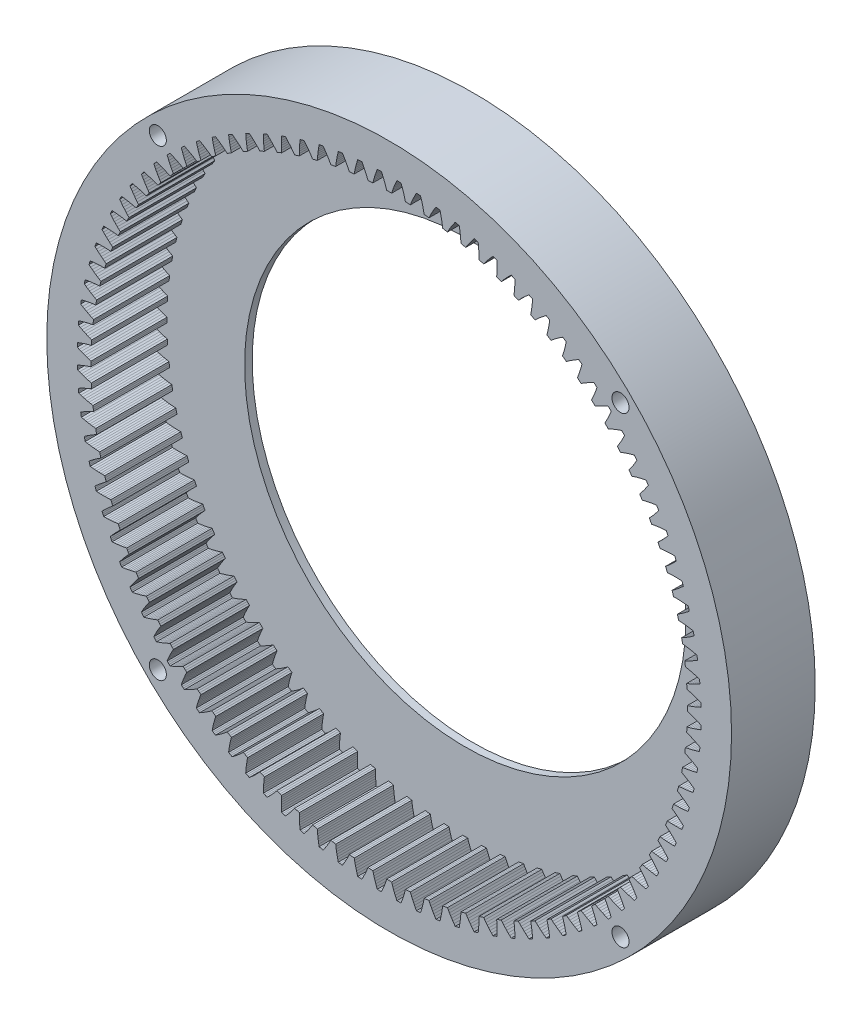
from build123d import *

# Parameters (mm, degrees)
INTERNAL_RING_TEETH_START = 35
SKETCH_1_R                = 90
INTERNAL_RING_TEETH_DEPTH = 20
RING_BACK_FLANGE_START    = 33
SKETCH_2_R                = 90
SKETCH_2_R_2              = 58
RING_BACK_FLANGE_DEPTH    = 2
SKETCH_3_R                = 2.25
THROUGH_HOLES_DEPTH       = 100


with BuildPart() as part:
    # Эскиз1 → Internal_ring_teeth (new body)
    with BuildSketch(Plane.XY.offset(INTERNAL_RING_TEETH_START)):
        Circle(SKETCH_1_R)
        Polygon((81.974683469, -2.037466591), (81.465701821, -1.805840391), (80.955920355, -1.584678023), (80.445404963, -1.374284213), (79.934221415, -1.175012738), (79.422435353, -0.987280005), (78.910112284, -0.811584339), (78.397317575, -0.648534495), (78.399701951, -0.216180357), (78.399701951, 0.216180357), (78.397317575, 0.648534495), (78.910112284, 0.811584339), (79.422435353, 0.987280005), (79.934221415, 1.175012738), (80.445404963, 1.374284213), (80.955920355, 1.584678023), (81.465701821, 1.805840391), (81.974683469, 2.037466591), (81.964979124, 2.39628822), (81.953704143, 2.75506393), (81.940858743, 3.113786847), (81.418337524, 3.312996763), (80.895675095, 3.501713275), (80.372956352, 3.679636395), (79.850269149, 3.846417172), (79.327705143, 4.001644144), (78.805361005, 4.144824084), (78.283340195, 4.27535354), (78.258572125, 4.707004242), (78.231423971, 5.13851179), (78.201896559, 5.569863061), (78.7034414, 5.764789809), (79.203721495, 5.972307812), (79.702709828, 6.19180541), (80.200372312, 6.422781148), (80.696669582, 6.664815321), (81.191558211, 6.917550719), (81.684991571, 7.18067908), (81.652775778, 7.538183315), (81.618995333, 7.895543101), (81.583650882, 8.252751591), (81.049652245, 8.418759033), (80.516171563, 8.57428491), (79.983312401, 8.719035158), (79.45118435, 8.852667031), (78.919904723, 8.974775633), (78.389600969, 9.08487478), (77.860414235, 9.182368708), (77.808591468, 9.611612446), (77.754402301, 10.040563866), (77.697848385, 10.469209921), (78.18616399, 10.695244287), (78.672426732, 10.933765648), (79.156648058, 11.184161854), (79.638825433, 11.445930301), (80.118945921, 11.718649638), (80.596988614, 12.001960634), (81.072926329, 12.295552708), (81.018326231, 12.650328644), (80.962173636, 13.004862171), (80.904469623, 13.359146495), (80.361101017, 13.491296307), (79.818907487, 13.613017761), (79.278010857, 13.724023873), (78.738542024, 13.823979457), (78.200643494, 13.912487782), (77.66447299, 13.989071625), (77.130208792, 14.053145261), (77.051535847, 14.478288007), (76.970519528, 14.902990423), (76.887162299, 15.327239593), (77.36032151, 15.583489523), (77.830647844, 15.852072906), (78.298191161, 16.132379521), (78.762980492, 16.423907595), (79.225029384, 16.726235798), (79.684339524, 17.039004294), (80.140903286, 17.361901408), (80.064134363, 17.712548906), (79.985831229, 18.062856991), (79.905995384, 18.412818951), (79.355401236, 18.510589599), (78.806634648, 18.598026249), (78.259835223, 18.674850136), (77.715154646, 18.740734952), (77.172760052, 18.795293698), (76.632838819, 18.838059996), (76.095605651, 18.868460471), (75.990393016, 19.287824379), (75.882869279, 19.706601685), (75.773037711, 20.124779653), (76.229173183, 20.410233844), (76.681706945, 20.707819275), (77.130727075, 21.016930057), (77.576294051, 21.33706723), (78.01844785, 21.667811148), (78.45721275, 22.008802788), (78.89260071, 22.359730614), (78.793965935, 22.704865829), (78.693821287, 23.049565966), (78.592168687, 23.393824422), (78.036521941, 23.45683005), (77.483348026, 23.509636825), (76.932803773, 23.551975297), (76.385061056, 23.583529328), (75.840310982, 23.603923176), (75.298769842, 23.61270315), (74.76068792, 23.609310487), (74.62935082, 24.02124052), (74.495744012, 24.432439994), (74.35987156, 24.842896402), (74.797183136, 25.156428298), (75.230138382, 25.481841341), (75.658863247, 25.818536371), (76.083449419, 26.166019209), (76.503963146, 26.523873545), (76.920451201, 26.891742593), (77.332945083, 27.269316179), (77.21283372, 27.607577019), (77.091242785, 27.945308836), (76.968174605, 28.282505156), (76.409668146, 28.310497109), (75.854270028, 28.328465604), (75.302153693, 28.336151572), (74.753510528, 28.333250288), (74.208554853, 28.319398753), (73.667531022, 28.294157752), (73.130723909, 28.25698534), (72.973780672, 28.659855799), (72.814618078, 29.061854624), (72.653240967, 29.462969588), (73.070002779, 29.803341821), (73.481670833, 30.155298221), (73.888408451, 30.518248717), (74.290338171, 30.891705863), (74.687552251, 31.275258331), (75.080119773, 31.668552975), (75.46809165, 32.071282211), (75.326977727, 32.401333716), (75.184420367, 32.730764338), (75.040422302, 33.059567763), (74.481260298, 33.052435569), (73.92582988, 33.035494872), (73.374320415, 33.008498001), (72.826942045, 32.971152853), (72.283931461, 32.923110602), (71.745560112, 32.863948241), (71.212146341, 32.793142782), (71.03021635, 33.185363721), (70.846126112, 33.576575391), (70.659881225, 33.966765893), (71.054448503, 34.332635171), (71.443204699, 34.709745916), (71.826349863, 35.097519478), (72.204036898, 35.495477068), (72.576383708, 35.903213962), (72.943481413, 36.320382047), (73.305400139, 36.746677544), (73.143840565, 37.067217151), (72.98087939, 37.387046466), (72.816519735, 37.70615936), (72.258908943, 37.663931167), (71.705638256, 37.612148134), (71.156912216, 37.55057497), (70.612958894, 37.478933342), (70.074036415, 37.396889974), (69.540442254, 37.304039739), (69.012526965, 37.199880671), (68.806328214, 37.579904173), (68.598036852, 37.958784754), (68.387659213, 38.336510892), (68.75847478, 38.726433294), (69.122784875, 39.127210101), (69.480825486, 39.538276365), (69.832779279, 39.959163841), (70.178789336, 40.389476009), (70.518968457, 40.828871163), (70.853405702, 41.277050529), (70.672038082, 41.586813215), (70.489316224, 41.895779003), (70.305243631, 42.203941972), (69.751384687, 42.126784436), (69.202457236, 42.04036343), (68.658680194, 41.944456974), (68.120298654, 41.838801602), (67.587591161, 41.723080906), (67.060880041, 41.596909235), (66.540546673, 41.459807627), (66.310892936, 41.826133912), (66.079222481, 42.191188136), (65.845542353, 42.554959196), (66.191142771, 42.967395878), (66.529568999, 43.390257063), (66.861092034, 43.822993738), (67.185923583, 44.26515005), (67.504231344, 44.716339246), (67.816149349, 45.176227379), (68.121785244, 45.644521853), (67.921325351, 45.942285126), (67.719563931, 46.23916804), (67.51650485, 46.535164907), (66.968583582, 46.423382532), (66.426165734, 46.302664619), (65.889483727, 46.172803369), (65.358798716, 46.033551227), (64.834408562, 45.884609899), (64.316659171, 45.725614735), (63.805961244, 45.556111662), (63.553758858, 45.907295009), (63.299623607, 46.257082173), (63.04356322, 46.605462518), (63.36258456, 47.03878578), (63.673791308, 47.482062504), (63.977488398, 47.934761775), (64.273915742, 48.396441935), (64.56326499, 48.866727522), (64.845690882, 49.345293664), (65.121319221, 49.831855102), (64.902558179, 50.116443827), (64.682553456, 50.400072206), (64.461309269, 50.682734805), (63.921488072, 50.536768746), (63.387720502, 50.382230344), (62.86025157, 50.218926803), (62.339357459, 50.046627457), (61.825354173, 49.8650533), (61.318609831, 49.673862123), (60.819562835, 49.472626538), (60.545807129, 49.807280985), (60.270210038, 50.14042064), (59.992779945, 50.472035371), (60.283963177, 50.924535084), (60.566722253, 51.386477937), (60.841394844, 51.857353207), (61.108248118, 52.336735174), (61.367496926, 52.824261149), (61.619316098, 53.319616618), (61.863849102, 53.822524786), (61.627650261, 54.09281582), (61.390270494, 54.362070312), (61.15171435, 54.630283104), (60.622123652, 54.450709422), (60.099112897, 54.262960423), (59.582938719, 54.066859076), (59.073891238, 53.862192511), (58.572303356, 53.648702116), (58.078563952, 53.426069471), (57.593137398, 53.193895558), (57.298908759, 53.510700379), (57.002937484, 53.825877774), (56.705232575, 54.139418159), (56.967428531, 54.609308514), (57.220624015, 55.088094417), (57.4651881, 55.575287357), (57.701414158, 56.070479229), (57.929539388, 56.57332155), (58.149758024, 57.083511405), (58.362230633, 57.600781553), (58.109526163, 57.855708181), (57.855708181, 58.109526163), (57.600781553, 58.362230633), (57.083511405, 58.149758024), (56.57332155, 57.929539388), (56.070479229, 57.701414158), (55.575287357, 57.4651881), (55.088094417, 57.220624015), (54.609308514, 56.967428531), (54.139418159, 56.705232575), (53.825877774, 57.002937484), (53.510700379, 57.298908759), (53.193895558, 57.593137398), (53.426069471, 58.078563952), (53.648702116, 58.572303356), (53.862192511, 59.073891238), (54.066859076, 59.582938719), (54.262960423, 60.099112897), (54.450709422, 60.622123652), (54.630283104, 61.15171435), (54.362070312, 61.390270494), (54.09281582, 61.627650261), (53.822524786, 61.863849102), (53.319616618, 61.619316098), (52.824261149, 61.367496926), (52.336735174, 61.108248118), (51.857353207, 60.841394844), (51.386477937, 60.566722253), (50.924535084, 60.283963177), (50.472035371, 59.992779945), (50.14042064, 60.270210038), (49.807280985, 60.545807129), (49.472626538, 60.819562835), (49.673862123, 61.318609831), (49.8650533, 61.825354173), (50.046627457, 62.339357459), (50.218926803, 62.86025157), (50.382230344, 63.387720502), (50.536768746, 63.921488072), (50.682734805, 64.461309269), (50.400072206, 64.682553456), (50.116443827, 64.902558179), (49.831855102, 65.121319221), (49.345293664, 64.845690882), (48.866727522, 64.56326499), (48.396441935, 64.273915742), (47.934761775, 63.977488398), (47.482062504, 63.673791308), (47.03878578, 63.36258456), (46.605462518, 63.04356322), (46.257082173, 63.299623607), (45.907295009, 63.553758858), (45.556111662, 63.805961244), (45.725614735, 64.316659171), (45.884609899, 64.834408562), (46.033551227, 65.358798716), (46.172803369, 65.889483727), (46.302664619, 66.426165734), (46.423382532, 66.968583582), (46.535164907, 67.51650485), (46.23916804, 67.719563931), (45.942285126, 67.921325351), (45.644521853, 68.121785244), (45.176227379, 67.816149349), (44.716339246, 67.504231344), (44.26515005, 67.185923583), (43.822993738, 66.861092034), (43.390257063, 66.529568999), (42.967395878, 66.191142771), (42.554959196, 65.845542353), (42.191188136, 66.079222481), (41.826133912, 66.310892936), (41.459807627, 66.540546673), (41.596909235, 67.060880041), (41.723080906, 67.587591161), (41.838801602, 68.120298654), (41.944456974, 68.658680194), (42.04036343, 69.202457236), (42.126784436, 69.751384687), (42.203941972, 70.305243631), (41.895779003, 70.489316224), (41.586813215, 70.672038082), (41.277050529, 70.853405702), (40.828871163, 70.518968457), (40.389476009, 70.178789336), (39.959163841, 69.832779279), (39.538276365, 69.480825486), (39.127210101, 69.122784875), (38.726433294, 68.75847478), (38.336510892, 68.387659213), (37.958784754, 68.598036852), (37.579904173, 68.806328214), (37.199880671, 69.012526965), (37.304039739, 69.540442254), (37.396889974, 70.074036415), (37.478933342, 70.612958894), (37.55057497, 71.156912216), (37.612148134, 71.705638256), (37.663931167, 72.258908943), (37.70615936, 72.816519735), (37.387046466, 72.98087939), (37.067217151, 73.143840565), (36.746677544, 73.305400139), (36.320382047, 72.943481413), (35.903213962, 72.576383708), (35.495477068, 72.204036898), (35.097519478, 71.826349863), (34.709745916, 71.443204699), (34.332635171, 71.054448503), (33.966765893, 70.659881225), (33.576575391, 70.846126112), (33.185363721, 71.03021635), (32.793142782, 71.212146341), (32.863948241, 71.745560112), (32.923110602, 72.283931461), (32.971152853, 72.826942045), (33.008498001, 73.374320415), (33.035494872, 73.92582988), (33.052435569, 74.481260298), (33.059567763, 75.040422302), (32.730764338, 75.184420367), (32.401333716, 75.326977727), (32.071282211, 75.46809165), (31.668552975, 75.080119773), (31.275258331, 74.687552251), (30.891705863, 74.290338171), (30.518248717, 73.888408451), (30.155298221, 73.481670833), (29.803341821, 73.070002779), (29.462969588, 72.653240967), (29.061854624, 72.814618078), (28.659855799, 72.973780672), (28.25698534, 73.130723909), (28.294157752, 73.667531022), (28.319398753, 74.208554853), (28.333250288, 74.753510528), (28.336151572, 75.302153693), (28.328465604, 75.854270028), (28.310497109, 76.409668146), (28.282505156, 76.968174605), (27.945308836, 77.091242785), (27.607577019, 77.21283372), (27.269316179, 77.332945083), (26.891742593, 76.920451201), (26.523873545, 76.503963146), (26.166019209, 76.083449419), (25.818536371, 75.658863247), (25.481841341, 75.230138382), (25.156428298, 74.797183136), (24.842896402, 74.35987156), (24.432439994, 74.495744012), (24.02124052, 74.62935082), (23.609310487, 74.76068792), (23.61270315, 75.298769842), (23.603923176, 75.840310982), (23.583529328, 76.385061056), (23.551975297, 76.932803773), (23.509636825, 77.483348026), (23.45683005, 78.036521941), (23.393824422, 78.592168687), (23.049565966, 78.693821287), (22.704865829, 78.793965935), (22.359730614, 78.89260071), (22.008802788, 78.45721275), (21.667811148, 78.01844785), (21.33706723, 77.576294051), (21.016930057, 77.130727075), (20.707819275, 76.681706945), (20.410233844, 76.229173183), (20.124779653, 75.773037711), (19.706601685, 75.882869279), (19.287824379, 75.990393016), (18.868460471, 76.095605651), (18.838059996, 76.632838819), (18.795293698, 77.172760052), (18.740734952, 77.715154646), (18.674850136, 78.259835223), (18.598026249, 78.806634648), (18.510589599, 79.355401236), (18.412818951, 79.905995384), (18.062856991, 79.985831229), (17.712548906, 80.064134363), (17.361901408, 80.140903286), (17.039004294, 79.684339524), (16.726235798, 79.225029384), (16.423907595, 78.762980492), (16.132379521, 78.298191161), (15.852072906, 77.830647844), (15.583489523, 77.36032151), (15.327239593, 76.887162299), (14.902990423, 76.970519528), (14.478288007, 77.051535847), (14.053145261, 77.130208792), (13.989071625, 77.66447299), (13.912487782, 78.200643494), (13.823979457, 78.738542024), (13.724023873, 79.278010857), (13.613017761, 79.818907487), (13.491296307, 80.361101017), (13.359146495, 80.904469623), (13.004862171, 80.962173636), (12.650328644, 81.018326231), (12.295552708, 81.072926329), (12.001960634, 80.596988614), (11.718649638, 80.118945921), (11.445930301, 79.638825433), (11.184161854, 79.156648058), (10.933765648, 78.672426732), (10.695244287, 78.18616399), (10.469209921, 77.697848385), (10.040563866, 77.754402301), (9.611612446, 77.808591468), (9.182368708, 77.860414235), (9.08487478, 78.389600969), (8.974775633, 78.919904723), (8.852667031, 79.45118435), (8.719035158, 79.983312401), (8.57428491, 80.516171563), (8.418759033, 81.049652245), (8.252751591, 81.583650882), (7.895543101, 81.618995333), (7.538183315, 81.652775778), (7.18067908, 81.684991571), (6.917550719, 81.191558211), (6.664815321, 80.696669582), (6.422781148, 80.200372312), (6.19180541, 79.702709828), (5.972307812, 79.203721495), (5.764789809, 78.7034414), (5.569863061, 78.201896559), (5.13851179, 78.231423971), (4.707004242, 78.258572125), (4.27535354, 78.283340195), (4.144824084, 78.805361005), (4.001644144, 79.327705143), (3.846417172, 79.850269149), (3.679636395, 80.372956352), (3.501713275, 80.895675095), (3.312996763, 81.418337524), (3.113786847, 81.940858743), (2.75506393, 81.953704143), (2.39628822, 81.964979124), (2.037466591, 81.974683469), (1.805840391, 81.465701821), (1.584678023, 80.955920355), (1.374284213, 80.445404963), (1.175012738, 79.934221415), (0.987280005, 79.422435353), (0.811584339, 78.910112284), (0.648534495, 78.397317575), (0.216180357, 78.399701951), (-0.216180357, 78.399701951), (-0.648534495, 78.397317575), (-0.811584339, 78.910112284), (-0.987280005, 79.422435353), (-1.175012738, 79.934221415), (-1.374284213, 80.445404963), (-1.584678023, 80.955920355), (-1.805840391, 81.465701821), (-2.037466591, 81.974683469), (-2.39628822, 81.964979124), (-2.75506393, 81.953704143), (-3.113786847, 81.940858743), (-3.312996763, 81.418337524), (-3.501713275, 80.895675095), (-3.679636395, 80.372956352), (-3.846417172, 79.850269149), (-4.001644144, 79.327705143), (-4.144824084, 78.805361005), (-4.27535354, 78.283340195), (-4.707004242, 78.258572125), (-5.13851179, 78.231423971), (-5.569863061, 78.201896559), (-5.764789809, 78.7034414), (-5.972307812, 79.203721495), (-6.19180541, 79.702709828), (-6.422781148, 80.200372312), (-6.664815321, 80.696669582), (-6.917550719, 81.191558211), (-7.18067908, 81.684991571), (-7.538183315, 81.652775778), (-7.895543101, 81.618995333), (-8.252751591, 81.583650882), (-8.418759033, 81.049652245), (-8.57428491, 80.516171563), (-8.719035158, 79.983312401), (-8.852667031, 79.45118435), (-8.974775633, 78.919904723), (-9.08487478, 78.389600969), (-9.182368708, 77.860414235), (-9.611612446, 77.808591468), (-10.040563866, 77.754402301), (-10.469209921, 77.697848385), (-10.695244287, 78.18616399), (-10.933765648, 78.672426732), (-11.184161854, 79.156648058), (-11.445930301, 79.638825433), (-11.718649638, 80.118945921), (-12.001960634, 80.596988614), (-12.295552708, 81.072926329), (-12.650328644, 81.018326231), (-13.004862171, 80.962173636), (-13.359146495, 80.904469623), (-13.491296307, 80.361101017), (-13.613017761, 79.818907487), (-13.724023873, 79.278010857), (-13.823979457, 78.738542024), (-13.912487782, 78.200643494), (-13.989071625, 77.66447299), (-14.053145261, 77.130208792), (-14.478288007, 77.051535847), (-14.902990423, 76.970519528), (-15.327239593, 76.887162299), (-15.583489523, 77.36032151), (-15.852072906, 77.830647844), (-16.132379521, 78.298191161), (-16.423907595, 78.762980492), (-16.726235798, 79.225029384), (-17.039004294, 79.684339524), (-17.361901408, 80.140903286), (-17.712548906, 80.064134363), (-18.062856991, 79.985831229), (-18.412818951, 79.905995384), (-18.510589599, 79.355401236), (-18.598026249, 78.806634648), (-18.674850136, 78.259835223), (-18.740734952, 77.715154646), (-18.795293698, 77.172760052), (-18.838059996, 76.632838819), (-18.868460471, 76.095605651), (-19.287824379, 75.990393016), (-19.706601685, 75.882869279), (-20.124779653, 75.773037711), (-20.410233844, 76.229173183), (-20.707819275, 76.681706945), (-21.016930057, 77.130727075), (-21.33706723, 77.576294051), (-21.667811148, 78.01844785), (-22.008802788, 78.45721275), (-22.359730614, 78.89260071), (-22.704865829, 78.793965935), (-23.049565966, 78.693821287), (-23.393824422, 78.592168687), (-23.45683005, 78.036521941), (-23.509636825, 77.483348026), (-23.551975297, 76.932803773), (-23.583529328, 76.385061056), (-23.603923176, 75.840310982), (-23.61270315, 75.298769842), (-23.609310487, 74.76068792), (-24.02124052, 74.62935082), (-24.432439994, 74.495744012), (-24.842896402, 74.35987156), (-25.156428298, 74.797183136), (-25.481841341, 75.230138382), (-25.818536371, 75.658863247), (-26.166019209, 76.083449419), (-26.523873545, 76.503963146), (-26.891742593, 76.920451201), (-27.269316179, 77.332945083), (-27.607577019, 77.21283372), (-27.945308836, 77.091242785), (-28.282505156, 76.968174605), (-28.310497109, 76.409668146), (-28.328465604, 75.854270028), (-28.336151572, 75.302153693), (-28.333250288, 74.753510528), (-28.319398753, 74.208554853), (-28.294157752, 73.667531022), (-28.25698534, 73.130723909), (-28.659855799, 72.973780672), (-29.061854624, 72.814618078), (-29.462969588, 72.653240967), (-29.803341821, 73.070002779), (-30.155298221, 73.481670833), (-30.518248717, 73.888408451), (-30.891705863, 74.290338171), (-31.275258331, 74.687552251), (-31.668552975, 75.080119773), (-32.071282211, 75.46809165), (-32.401333716, 75.326977727), (-32.730764338, 75.184420367), (-33.059567763, 75.040422302), (-33.052435569, 74.481260298), (-33.035494872, 73.92582988), (-33.008498001, 73.374320415), (-32.971152853, 72.826942045), (-32.923110602, 72.283931461), (-32.863948241, 71.745560112), (-32.793142782, 71.212146341), (-33.185363721, 71.03021635), (-33.576575391, 70.846126112), (-33.966765893, 70.659881225), (-34.332635171, 71.054448503), (-34.709745916, 71.443204699), (-35.097519478, 71.826349863), (-35.495477068, 72.204036898), (-35.903213962, 72.576383708), (-36.320382047, 72.943481413), (-36.746677544, 73.305400139), (-37.067217151, 73.143840565), (-37.387046466, 72.98087939), (-37.70615936, 72.816519735), (-37.663931167, 72.258908943), (-37.612148134, 71.705638256), (-37.55057497, 71.156912216), (-37.478933342, 70.612958894), (-37.396889974, 70.074036415), (-37.304039739, 69.540442254), (-37.199880671, 69.012526965), (-37.579904173, 68.806328214), (-37.958784754, 68.598036852), (-38.336510892, 68.387659213), (-38.726433294, 68.75847478), (-39.127210101, 69.122784875), (-39.538276365, 69.480825486), (-39.959163841, 69.832779279), (-40.389476009, 70.178789336), (-40.828871163, 70.518968457), (-41.277050529, 70.853405702), (-41.586813215, 70.672038082), (-41.895779003, 70.489316224), (-42.203941972, 70.305243631), (-42.126784436, 69.751384687), (-42.04036343, 69.202457236), (-41.944456974, 68.658680194), (-41.838801602, 68.120298654), (-41.723080906, 67.587591161), (-41.596909235, 67.060880041), (-41.459807627, 66.540546673), (-41.826133912, 66.310892936), (-42.191188136, 66.079222481), (-42.554959196, 65.845542353), (-42.967395878, 66.191142771), (-43.390257063, 66.529568999), (-43.822993738, 66.861092034), (-44.26515005, 67.185923583), (-44.716339246, 67.504231344), (-45.176227379, 67.816149349), (-45.644521853, 68.121785244), (-45.942285126, 67.921325351), (-46.23916804, 67.719563931), (-46.535164907, 67.51650485), (-46.423382532, 66.968583582), (-46.302664619, 66.426165734), (-46.172803369, 65.889483727), (-46.033551227, 65.358798716), (-45.884609899, 64.834408562), (-45.725614735, 64.316659171), (-45.556111662, 63.805961244), (-45.907295009, 63.553758858), (-46.257082173, 63.299623607), (-46.605462518, 63.04356322), (-47.03878578, 63.36258456), (-47.482062504, 63.673791308), (-47.934761775, 63.977488398), (-48.396441935, 64.273915742), (-48.866727522, 64.56326499), (-49.345293664, 64.845690882), (-49.831855102, 65.121319221), (-50.116443827, 64.902558179), (-50.400072206, 64.682553456), (-50.682734805, 64.461309269), (-50.536768746, 63.921488072), (-50.382230344, 63.387720502), (-50.218926803, 62.86025157), (-50.046627457, 62.339357459), (-49.8650533, 61.825354173), (-49.673862123, 61.318609831), (-49.472626538, 60.819562835), (-49.807280985, 60.545807129), (-50.14042064, 60.270210038), (-50.472035371, 59.992779945), (-50.924535084, 60.283963177), (-51.386477937, 60.566722253), (-51.857353207, 60.841394844), (-52.336735174, 61.108248118), (-52.824261149, 61.367496926), (-53.319616618, 61.619316098), (-53.822524786, 61.863849102), (-54.09281582, 61.627650261), (-54.362070312, 61.390270494), (-54.630283104, 61.15171435), (-54.450709422, 60.622123652), (-54.262960423, 60.099112897), (-54.066859076, 59.582938719), (-53.862192511, 59.073891238), (-53.648702116, 58.572303356), (-53.426069471, 58.078563952), (-53.193895558, 57.593137398), (-53.510700379, 57.298908759), (-53.825877774, 57.002937484), (-54.139418159, 56.705232575), (-54.609308514, 56.967428531), (-55.088094417, 57.220624015), (-55.575287357, 57.4651881), (-56.070479229, 57.701414158), (-56.57332155, 57.929539388), (-57.083511405, 58.149758024), (-57.600781553, 58.362230633), (-57.855708181, 58.109526163), (-58.109526163, 57.855708181), (-58.362230633, 57.600781553), (-58.149758024, 57.083511405), (-57.929539388, 56.57332155), (-57.701414158, 56.070479229), (-57.4651881, 55.575287357), (-57.220624015, 55.088094417), (-56.967428531, 54.609308514), (-56.705232575, 54.139418159), (-57.002937484, 53.825877774), (-57.298908759, 53.510700379), (-57.593137398, 53.193895558), (-58.078563952, 53.426069471), (-58.572303356, 53.648702116), (-59.073891238, 53.862192511), (-59.582938719, 54.066859076), (-60.099112897, 54.262960423), (-60.622123652, 54.450709422), (-61.15171435, 54.630283104), (-61.390270494, 54.362070312), (-61.627650261, 54.09281582), (-61.863849102, 53.822524786), (-61.619316098, 53.319616618), (-61.367496926, 52.824261149), (-61.108248118, 52.336735174), (-60.841394844, 51.857353207), (-60.566722253, 51.386477937), (-60.283963177, 50.924535084), (-59.992779945, 50.472035371), (-60.270210038, 50.14042064), (-60.545807129, 49.807280985), (-60.819562835, 49.472626538), (-61.318609831, 49.673862123), (-61.825354173, 49.8650533), (-62.339357459, 50.046627457), (-62.86025157, 50.218926803), (-63.387720502, 50.382230344), (-63.921488072, 50.536768746), (-64.461309269, 50.682734805), (-64.682553456, 50.400072206), (-64.902558179, 50.116443827), (-65.121319221, 49.831855102), (-64.845690882, 49.345293664), (-64.56326499, 48.866727522), (-64.273915742, 48.396441935), (-63.977488398, 47.934761775), (-63.673791308, 47.482062504), (-63.36258456, 47.03878578), (-63.04356322, 46.605462518), (-63.299623607, 46.257082173), (-63.553758858, 45.907295009), (-63.805961244, 45.556111662), (-64.316659171, 45.725614735), (-64.834408562, 45.884609899), (-65.358798716, 46.033551227), (-65.889483727, 46.172803369), (-66.426165734, 46.302664619), (-66.968583582, 46.423382532), (-67.51650485, 46.535164907), (-67.719563931, 46.23916804), (-67.921325351, 45.942285126), (-68.121785244, 45.644521853), (-67.816149349, 45.176227379), (-67.504231344, 44.716339246), (-67.185923583, 44.26515005), (-66.861092034, 43.822993738), (-66.529568999, 43.390257063), (-66.191142771, 42.967395878), (-65.845542353, 42.554959196), (-66.079222481, 42.191188136), (-66.310892936, 41.826133912), (-66.540546673, 41.459807627), (-67.060880041, 41.596909235), (-67.587591161, 41.723080906), (-68.120298654, 41.838801602), (-68.658680194, 41.944456974), (-69.202457236, 42.04036343), (-69.751384687, 42.126784436), (-70.305243631, 42.203941972), (-70.489316224, 41.895779003), (-70.672038082, 41.586813215), (-70.853405702, 41.277050529), (-70.518968457, 40.828871163), (-70.178789336, 40.389476009), (-69.832779279, 39.959163841), (-69.480825486, 39.538276365), (-69.122784875, 39.127210101), (-68.75847478, 38.726433294), (-68.387659213, 38.336510892), (-68.598036852, 37.958784754), (-68.806328214, 37.579904173), (-69.012526965, 37.199880671), (-69.540442254, 37.304039739), (-70.074036415, 37.396889974), (-70.612958894, 37.478933342), (-71.156912216, 37.55057497), (-71.705638256, 37.612148134), (-72.258908943, 37.663931167), (-72.816519735, 37.70615936), (-72.98087939, 37.387046466), (-73.143840565, 37.067217151), (-73.305400139, 36.746677544), (-72.943481413, 36.320382047), (-72.576383708, 35.903213962), (-72.204036898, 35.495477068), (-71.826349863, 35.097519478), (-71.443204699, 34.709745916), (-71.054448503, 34.332635171), (-70.659881225, 33.966765893), (-70.846126112, 33.576575391), (-71.03021635, 33.185363721), (-71.212146341, 32.793142782), (-71.745560112, 32.863948241), (-72.283931461, 32.923110602), (-72.826942045, 32.971152853), (-73.374320415, 33.008498001), (-73.92582988, 33.035494872), (-74.481260298, 33.052435569), (-75.040422302, 33.059567763), (-75.184420367, 32.730764338), (-75.326977727, 32.401333716), (-75.46809165, 32.071282211), (-75.080119773, 31.668552975), (-74.687552251, 31.275258331), (-74.290338171, 30.891705863), (-73.888408451, 30.518248717), (-73.481670833, 30.155298221), (-73.070002779, 29.803341821), (-72.653240967, 29.462969588), (-72.814618078, 29.061854624), (-72.973780672, 28.659855799), (-73.130723909, 28.25698534), (-73.667531022, 28.294157752), (-74.208554853, 28.319398753), (-74.753510528, 28.333250288), (-75.302153693, 28.336151572), (-75.854270028, 28.328465604), (-76.409668146, 28.310497109), (-76.968174605, 28.282505156), (-77.091242785, 27.945308836), (-77.21283372, 27.607577019), (-77.332945083, 27.269316179), (-76.920451201, 26.891742593), (-76.503963146, 26.523873545), (-76.083449419, 26.166019209), (-75.658863247, 25.818536371), (-75.230138382, 25.481841341), (-74.797183136, 25.156428298), (-74.35987156, 24.842896402), (-74.495744012, 24.432439994), (-74.62935082, 24.02124052), (-74.76068792, 23.609310487), (-75.298769842, 23.61270315), (-75.840310982, 23.603923176), (-76.385061056, 23.583529328), (-76.932803773, 23.551975297), (-77.483348026, 23.509636825), (-78.036521941, 23.45683005), (-78.592168687, 23.393824422), (-78.693821287, 23.049565966), (-78.793965935, 22.704865829), (-78.89260071, 22.359730614), (-78.45721275, 22.008802788), (-78.01844785, 21.667811148), (-77.576294051, 21.33706723), (-77.130727075, 21.016930057), (-76.681706945, 20.707819275), (-76.229173183, 20.410233844), (-75.773037711, 20.124779653), (-75.882869279, 19.706601685), (-75.990393016, 19.287824379), (-76.095605651, 18.868460471), (-76.632838819, 18.838059996), (-77.172760052, 18.795293698), (-77.715154646, 18.740734952), (-78.259835223, 18.674850136), (-78.806634648, 18.598026249), (-79.355401236, 18.510589599), (-79.905995384, 18.412818951), (-79.985831229, 18.062856991), (-80.064134363, 17.712548906), (-80.140903286, 17.361901408), (-79.684339524, 17.039004294), (-79.225029384, 16.726235798), (-78.762980492, 16.423907595), (-78.298191161, 16.132379521), (-77.830647844, 15.852072906), (-77.36032151, 15.583489523), (-76.887162299, 15.327239593), (-76.970519528, 14.902990423), (-77.051535847, 14.478288007), (-77.130208792, 14.053145261), (-77.66447299, 13.989071625), (-78.200643494, 13.912487782), (-78.738542024, 13.823979457), (-79.278010857, 13.724023873), (-79.818907487, 13.613017761), (-80.361101017, 13.491296307), (-80.904469623, 13.359146495), (-80.962173636, 13.004862171), (-81.018326231, 12.650328644), (-81.072926329, 12.295552708), (-80.596988614, 12.001960634), (-80.118945921, 11.718649638), (-79.638825433, 11.445930301), (-79.156648058, 11.184161854), (-78.672426732, 10.933765648), (-78.18616399, 10.695244287), (-77.697848385, 10.469209921), (-77.754402301, 10.040563866), (-77.808591468, 9.611612446), (-77.860414235, 9.182368708), (-78.389600969, 9.08487478), (-78.919904723, 8.974775633), (-79.45118435, 8.852667031), (-79.983312401, 8.719035158), (-80.516171563, 8.57428491), (-81.049652245, 8.418759033), (-81.583650882, 8.252751591), (-81.618995333, 7.895543101), (-81.652775778, 7.538183315), (-81.684991571, 7.18067908), (-81.191558211, 6.917550719), (-80.696669582, 6.664815321), (-80.200372312, 6.422781148), (-79.702709828, 6.19180541), (-79.203721495, 5.972307812), (-78.7034414, 5.764789809), (-78.201896559, 5.569863061), (-78.231423971, 5.13851179), (-78.258572125, 4.707004242), (-78.283340195, 4.27535354), (-78.805361005, 4.144824084), (-79.327705143, 4.001644144), (-79.850269149, 3.846417172), (-80.372956352, 3.679636395), (-80.895675095, 3.501713275), (-81.418337524, 3.312996763), (-81.940858743, 3.113786847), (-81.953704143, 2.75506393), (-81.964979124, 2.39628822), (-81.974683469, 2.037466591), (-81.465701821, 1.805840391), (-80.955920355, 1.584678023), (-80.445404963, 1.374284213), (-79.934221415, 1.175012738), (-79.422435353, 0.987280005), (-78.910112284, 0.811584339), (-78.397317575, 0.648534495), (-78.399701951, 0.216180357), (-78.399701951, -0.216180357), (-78.397317575, -0.648534495), (-78.910112284, -0.811584339), (-79.422435353, -0.987280005), (-79.934221415, -1.175012738), (-80.445404963, -1.374284213), (-80.955920355, -1.584678023), (-81.465701821, -1.805840391), (-81.974683469, -2.037466591), (-81.964979124, -2.39628822), (-81.953704143, -2.75506393), (-81.940858743, -3.113786847), (-81.418337524, -3.312996763), (-80.895675095, -3.501713275), (-80.372956352, -3.679636395), (-79.850269149, -3.846417172), (-79.327705143, -4.001644144), (-78.805361005, -4.144824084), (-78.283340195, -4.27535354), (-78.258572125, -4.707004242), (-78.231423971, -5.13851179), (-78.201896559, -5.569863061), (-78.7034414, -5.764789809), (-79.203721495, -5.972307812), (-79.702709828, -6.19180541), (-80.200372312, -6.422781148), (-80.696669582, -6.664815321), (-81.191558211, -6.917550719), (-81.684991571, -7.18067908), (-81.652775778, -7.538183315), (-81.618995333, -7.895543101), (-81.583650882, -8.252751591), (-81.049652245, -8.418759033), (-80.516171563, -8.57428491), (-79.983312401, -8.719035158), (-79.45118435, -8.852667031), (-78.919904723, -8.974775633), (-78.389600969, -9.08487478), (-77.860414235, -9.182368708), (-77.808591468, -9.611612446), (-77.754402301, -10.040563866), (-77.697848385, -10.469209921), (-78.18616399, -10.695244287), (-78.672426732, -10.933765648), (-79.156648058, -11.184161854), (-79.638825433, -11.445930301), (-80.118945921, -11.718649638), (-80.596988614, -12.001960634), (-81.072926329, -12.295552708), (-81.018326231, -12.650328644), (-80.962173636, -13.004862171), (-80.904469623, -13.359146495), (-80.361101017, -13.491296307), (-79.818907487, -13.613017761), (-79.278010857, -13.724023873), (-78.738542024, -13.823979457), (-78.200643494, -13.912487782), (-77.66447299, -13.989071625), (-77.130208792, -14.053145261), (-77.051535847, -14.478288007), (-76.970519528, -14.902990423), (-76.887162299, -15.327239593), (-77.36032151, -15.583489523), (-77.830647844, -15.852072906), (-78.298191161, -16.132379521), (-78.762980492, -16.423907595), (-79.225029384, -16.726235798), (-79.684339524, -17.039004294), (-80.140903286, -17.361901408), (-80.064134363, -17.712548906), (-79.985831229, -18.062856991), (-79.905995384, -18.412818951), (-79.355401236, -18.510589599), (-78.806634648, -18.598026249), (-78.259835223, -18.674850136), (-77.715154646, -18.740734952), (-77.172760052, -18.795293698), (-76.632838819, -18.838059996), (-76.095605651, -18.868460471), (-75.990393016, -19.287824379), (-75.882869279, -19.706601685), (-75.773037711, -20.124779653), (-76.229173183, -20.410233844), (-76.681706945, -20.707819275), (-77.130727075, -21.016930057), (-77.576294051, -21.33706723), (-78.01844785, -21.667811148), (-78.45721275, -22.008802788), (-78.89260071, -22.359730614), (-78.793965935, -22.704865829), (-78.693821287, -23.049565966), (-78.592168687, -23.393824422), (-78.036521941, -23.45683005), (-77.483348026, -23.509636825), (-76.932803773, -23.551975297), (-76.385061056, -23.583529328), (-75.840310982, -23.603923176), (-75.298769842, -23.61270315), (-74.76068792, -23.609310487), (-74.62935082, -24.02124052), (-74.495744012, -24.432439994), (-74.35987156, -24.842896402), (-74.797183136, -25.156428298), (-75.230138382, -25.481841341), (-75.658863247, -25.818536371), (-76.083449419, -26.166019209), (-76.503963146, -26.523873545), (-76.920451201, -26.891742593), (-77.332945083, -27.269316179), (-77.21283372, -27.607577019), (-77.091242785, -27.945308836), (-76.968174605, -28.282505156), (-76.409668146, -28.310497109), (-75.854270028, -28.328465604), (-75.302153693, -28.336151572), (-74.753510528, -28.333250288), (-74.208554853, -28.319398753), (-73.667531022, -28.294157752), (-73.130723909, -28.25698534), (-72.973780672, -28.659855799), (-72.814618078, -29.061854624), (-72.653240967, -29.462969588), (-73.070002779, -29.803341821), (-73.481670833, -30.155298221), (-73.888408451, -30.518248717), (-74.290338171, -30.891705863), (-74.687552251, -31.275258331), (-75.080119773, -31.668552975), (-75.46809165, -32.071282211), (-75.326977727, -32.401333716), (-75.184420367, -32.730764338), (-75.040422302, -33.059567763), (-74.481260298, -33.052435569), (-73.92582988, -33.035494872), (-73.374320415, -33.008498001), (-72.826942045, -32.971152853), (-72.283931461, -32.923110602), (-71.745560112, -32.863948241), (-71.212146341, -32.793142782), (-71.03021635, -33.185363721), (-70.846126112, -33.576575391), (-70.659881225, -33.966765893), (-71.054448503, -34.332635171), (-71.443204699, -34.709745916), (-71.826349863, -35.097519478), (-72.204036898, -35.495477068), (-72.576383708, -35.903213962), (-72.943481413, -36.320382047), (-73.305400139, -36.746677544), (-73.143840565, -37.067217151), (-72.98087939, -37.387046466), (-72.816519735, -37.70615936), (-72.258908943, -37.663931167), (-71.705638256, -37.612148134), (-71.156912216, -37.55057497), (-70.612958894, -37.478933342), (-70.074036415, -37.396889974), (-69.540442254, -37.304039739), (-69.012526965, -37.199880671), (-68.806328214, -37.579904173), (-68.598036852, -37.958784754), (-68.387659213, -38.336510892), (-68.75847478, -38.726433294), (-69.122784875, -39.127210101), (-69.480825486, -39.538276365), (-69.832779279, -39.959163841), (-70.178789336, -40.389476009), (-70.518968457, -40.828871163), (-70.853405702, -41.277050529), (-70.672038082, -41.586813215), (-70.489316224, -41.895779003), (-70.305243631, -42.203941972), (-69.751384687, -42.126784436), (-69.202457236, -42.04036343), (-68.658680194, -41.944456974), (-68.120298654, -41.838801602), (-67.587591161, -41.723080906), (-67.060880041, -41.596909235), (-66.540546673, -41.459807627), (-66.310892936, -41.826133912), (-66.079222481, -42.191188136), (-65.845542353, -42.554959196), (-66.191142771, -42.967395878), (-66.529568999, -43.390257063), (-66.861092034, -43.822993738), (-67.185923583, -44.26515005), (-67.504231344, -44.716339246), (-67.816149349, -45.176227379), (-68.121785244, -45.644521853), (-67.921325351, -45.942285126), (-67.719563931, -46.23916804), (-67.51650485, -46.535164907), (-66.968583582, -46.423382532), (-66.426165734, -46.302664619), (-65.889483727, -46.172803369), (-65.358798716, -46.033551227), (-64.834408562, -45.884609899), (-64.316659171, -45.725614735), (-63.805961244, -45.556111662), (-63.553758858, -45.907295009), (-63.299623607, -46.257082173), (-63.04356322, -46.605462518), (-63.36258456, -47.03878578), (-63.673791308, -47.482062504), (-63.977488398, -47.934761775), (-64.273915742, -48.396441935), (-64.56326499, -48.866727522), (-64.845690882, -49.345293664), (-65.121319221, -49.831855102), (-64.902558179, -50.116443827), (-64.682553456, -50.400072206), (-64.461309269, -50.682734805), (-63.921488072, -50.536768746), (-63.387720502, -50.382230344), (-62.86025157, -50.218926803), (-62.339357459, -50.046627457), (-61.825354173, -49.8650533), (-61.318609831, -49.673862123), (-60.819562835, -49.472626538), (-60.545807129, -49.807280985), (-60.270210038, -50.14042064), (-59.992779945, -50.472035371), (-60.283963177, -50.924535084), (-60.566722253, -51.386477937), (-60.841394844, -51.857353207), (-61.108248118, -52.336735174), (-61.367496926, -52.824261149), (-61.619316098, -53.319616618), (-61.863849102, -53.822524786), (-61.627650261, -54.09281582), (-61.390270494, -54.362070312), (-61.15171435, -54.630283104), (-60.622123652, -54.450709422), (-60.099112897, -54.262960423), (-59.582938719, -54.066859076), (-59.073891238, -53.862192511), (-58.572303356, -53.648702116), (-58.078563952, -53.426069471), (-57.593137398, -53.193895558), (-57.298908759, -53.510700379), (-57.002937484, -53.825877774), (-56.705232575, -54.139418159), (-56.967428531, -54.609308514), (-57.220624015, -55.088094417), (-57.4651881, -55.575287357), (-57.701414158, -56.070479229), (-57.929539388, -56.57332155), (-58.149758024, -57.083511405), (-58.362230633, -57.600781553), (-58.109526163, -57.855708181), (-57.855708181, -58.109526163), (-57.600781553, -58.362230633), (-57.083511405, -58.149758024), (-56.57332155, -57.929539388), (-56.070479229, -57.701414158), (-55.575287357, -57.4651881), (-55.088094417, -57.220624015), (-54.609308514, -56.967428531), (-54.139418159, -56.705232575), (-53.825877774, -57.002937484), (-53.510700379, -57.298908759), (-53.193895558, -57.593137398), (-53.426069471, -58.078563952), (-53.648702116, -58.572303356), (-53.862192511, -59.073891238), (-54.066859076, -59.582938719), (-54.262960423, -60.099112897), (-54.450709422, -60.622123652), (-54.630283104, -61.15171435), (-54.362070312, -61.390270494), (-54.09281582, -61.627650261), (-53.822524786, -61.863849102), (-53.319616618, -61.619316098), (-52.824261149, -61.367496926), (-52.336735174, -61.108248118), (-51.857353207, -60.841394844), (-51.386477937, -60.566722253), (-50.924535084, -60.283963177), (-50.472035371, -59.992779945), (-50.14042064, -60.270210038), (-49.807280985, -60.545807129), (-49.472626538, -60.819562835), (-49.673862123, -61.318609831), (-49.8650533, -61.825354173), (-50.046627457, -62.339357459), (-50.218926803, -62.86025157), (-50.382230344, -63.387720502), (-50.536768746, -63.921488072), (-50.682734805, -64.461309269), (-50.400072206, -64.682553456), (-50.116443827, -64.902558179), (-49.831855102, -65.121319221), (-49.345293664, -64.845690882), (-48.866727522, -64.56326499), (-48.396441935, -64.273915742), (-47.934761775, -63.977488398), (-47.482062504, -63.673791308), (-47.03878578, -63.36258456), (-46.605462518, -63.04356322), (-46.257082173, -63.299623607), (-45.907295009, -63.553758858), (-45.556111662, -63.805961244), (-45.725614735, -64.316659171), (-45.884609899, -64.834408562), (-46.033551227, -65.358798716), (-46.172803369, -65.889483727), (-46.302664619, -66.426165734), (-46.423382532, -66.968583582), (-46.535164907, -67.51650485), (-46.23916804, -67.719563931), (-45.942285126, -67.921325351), (-45.644521853, -68.121785244), (-45.176227379, -67.816149349), (-44.716339246, -67.504231344), (-44.26515005, -67.185923583), (-43.822993738, -66.861092034), (-43.390257063, -66.529568999), (-42.967395878, -66.191142771), (-42.554959196, -65.845542353), (-42.191188136, -66.079222481), (-41.826133912, -66.310892936), (-41.459807627, -66.540546673), (-41.596909235, -67.060880041), (-41.723080906, -67.587591161), (-41.838801602, -68.120298654), (-41.944456974, -68.658680194), (-42.04036343, -69.202457236), (-42.126784436, -69.751384687), (-42.203941972, -70.305243631), (-41.895779003, -70.489316224), (-41.586813215, -70.672038082), (-41.277050529, -70.853405702), (-40.828871163, -70.518968457), (-40.389476009, -70.178789336), (-39.959163841, -69.832779279), (-39.538276365, -69.480825486), (-39.127210101, -69.122784875), (-38.726433294, -68.75847478), (-38.336510892, -68.387659213), (-37.958784754, -68.598036852), (-37.579904173, -68.806328214), (-37.199880671, -69.012526965), (-37.304039739, -69.540442254), (-37.396889974, -70.074036415), (-37.478933342, -70.612958894), (-37.55057497, -71.156912216), (-37.612148134, -71.705638256), (-37.663931167, -72.258908943), (-37.70615936, -72.816519735), (-37.387046466, -72.98087939), (-37.067217151, -73.143840565), (-36.746677544, -73.305400139), (-36.320382047, -72.943481413), (-35.903213962, -72.576383708), (-35.495477068, -72.204036898), (-35.097519478, -71.826349863), (-34.709745916, -71.443204699), (-34.332635171, -71.054448503), (-33.966765893, -70.659881225), (-33.576575391, -70.846126112), (-33.185363721, -71.03021635), (-32.793142782, -71.212146341), (-32.863948241, -71.745560112), (-32.923110602, -72.283931461), (-32.971152853, -72.826942045), (-33.008498001, -73.374320415), (-33.035494872, -73.92582988), (-33.052435569, -74.481260298), (-33.059567763, -75.040422302), (-32.730764338, -75.184420367), (-32.401333716, -75.326977727), (-32.071282211, -75.46809165), (-31.668552975, -75.080119773), (-31.275258331, -74.687552251), (-30.891705863, -74.290338171), (-30.518248717, -73.888408451), (-30.155298221, -73.481670833), (-29.803341821, -73.070002779), (-29.462969588, -72.653240967), (-29.061854624, -72.814618078), (-28.659855799, -72.973780672), (-28.25698534, -73.130723909), (-28.294157752, -73.667531022), (-28.319398753, -74.208554853), (-28.333250288, -74.753510528), (-28.336151572, -75.302153693), (-28.328465604, -75.854270028), (-28.310497109, -76.409668146), (-28.282505156, -76.968174605), (-27.945308836, -77.091242785), (-27.607577019, -77.21283372), (-27.269316179, -77.332945083), (-26.891742593, -76.920451201), (-26.523873545, -76.503963146), (-26.166019209, -76.083449419), (-25.818536371, -75.658863247), (-25.481841341, -75.230138382), (-25.156428298, -74.797183136), (-24.842896402, -74.35987156), (-24.432439994, -74.495744012), (-24.02124052, -74.62935082), (-23.609310487, -74.76068792), (-23.61270315, -75.298769842), (-23.603923176, -75.840310982), (-23.583529328, -76.385061056), (-23.551975297, -76.932803773), (-23.509636825, -77.483348026), (-23.45683005, -78.036521941), (-23.393824422, -78.592168687), (-23.049565966, -78.693821287), (-22.704865829, -78.793965935), (-22.359730614, -78.89260071), (-22.008802788, -78.45721275), (-21.667811148, -78.01844785), (-21.33706723, -77.576294051), (-21.016930057, -77.130727075), (-20.707819275, -76.681706945), (-20.410233844, -76.229173183), (-20.124779653, -75.773037711), (-19.706601685, -75.882869279), (-19.287824379, -75.990393016), (-18.868460471, -76.095605651), (-18.838059996, -76.632838819), (-18.795293698, -77.172760052), (-18.740734952, -77.715154646), (-18.674850136, -78.259835223), (-18.598026249, -78.806634648), (-18.510589599, -79.355401236), (-18.412818951, -79.905995384), (-18.062856991, -79.985831229), (-17.712548906, -80.064134363), (-17.361901408, -80.140903286), (-17.039004294, -79.684339524), (-16.726235798, -79.225029384), (-16.423907595, -78.762980492), (-16.132379521, -78.298191161), (-15.852072906, -77.830647844), (-15.583489523, -77.36032151), (-15.327239593, -76.887162299), (-14.902990423, -76.970519528), (-14.478288007, -77.051535847), (-14.053145261, -77.130208792), (-13.989071625, -77.66447299), (-13.912487782, -78.200643494), (-13.823979457, -78.738542024), (-13.724023873, -79.278010857), (-13.613017761, -79.818907487), (-13.491296307, -80.361101017), (-13.359146495, -80.904469623), (-13.004862171, -80.962173636), (-12.650328644, -81.018326231), (-12.295552708, -81.072926329), (-12.001960634, -80.596988614), (-11.718649638, -80.118945921), (-11.445930301, -79.638825433), (-11.184161854, -79.156648058), (-10.933765648, -78.672426732), (-10.695244287, -78.18616399), (-10.469209921, -77.697848385), (-10.040563866, -77.754402301), (-9.611612446, -77.808591468), (-9.182368708, -77.860414235), (-9.08487478, -78.389600969), (-8.974775633, -78.919904723), (-8.852667031, -79.45118435), (-8.719035158, -79.983312401), (-8.57428491, -80.516171563), (-8.418759033, -81.049652245), (-8.252751591, -81.583650882), (-7.895543101, -81.618995333), (-7.538183315, -81.652775778), (-7.18067908, -81.684991571), (-6.917550719, -81.191558211), (-6.664815321, -80.696669582), (-6.422781148, -80.200372312), (-6.19180541, -79.702709828), (-5.972307812, -79.203721495), (-5.764789809, -78.7034414), (-5.569863061, -78.201896559), (-5.13851179, -78.231423971), (-4.707004242, -78.258572125), (-4.27535354, -78.283340195), (-4.144824084, -78.805361005), (-4.001644144, -79.327705143), (-3.846417172, -79.850269149), (-3.679636395, -80.372956352), (-3.501713275, -80.895675095), (-3.312996763, -81.418337524), (-3.113786847, -81.940858743), (-2.75506393, -81.953704143), (-2.39628822, -81.964979124), (-2.037466591, -81.974683469), (-1.805840391, -81.465701821), (-1.584678023, -80.955920355), (-1.374284213, -80.445404963), (-1.175012738, -79.934221415), (-0.987280005, -79.422435353), (-0.811584339, -78.910112284), (-0.648534495, -78.397317575), (-0.216180357, -78.399701951), (0.216180357, -78.399701951), (0.648534495, -78.397317575), (0.811584339, -78.910112284), (0.987280005, -79.422435353), (1.175012738, -79.934221415), (1.374284213, -80.445404963), (1.584678023, -80.955920355), (1.805840391, -81.465701821), (2.037466591, -81.974683469), (2.39628822, -81.964979124), (2.75506393, -81.953704143), (3.113786847, -81.940858743), (3.312996763, -81.418337524), (3.501713275, -80.895675095), (3.679636395, -80.372956352), (3.846417172, -79.850269149), (4.001644144, -79.327705143), (4.144824084, -78.805361005), (4.27535354, -78.283340195), (4.707004242, -78.258572125), (5.13851179, -78.231423971), (5.569863061, -78.201896559), (5.764789809, -78.7034414), (5.972307812, -79.203721495), (6.19180541, -79.702709828), (6.422781148, -80.200372312), (6.664815321, -80.696669582), (6.917550719, -81.191558211), (7.18067908, -81.684991571), (7.538183315, -81.652775778), (7.895543101, -81.618995333), (8.252751591, -81.583650882), (8.418759033, -81.049652245), (8.57428491, -80.516171563), (8.719035158, -79.983312401), (8.852667031, -79.45118435), (8.974775633, -78.919904723), (9.08487478, -78.389600969), (9.182368708, -77.860414235), (9.611612446, -77.808591468), (10.040563866, -77.754402301), (10.469209921, -77.697848385), (10.695244287, -78.18616399), (10.933765648, -78.672426732), (11.184161854, -79.156648058), (11.445930301, -79.638825433), (11.718649638, -80.118945921), (12.001960634, -80.596988614), (12.295552708, -81.072926329), (12.650328644, -81.018326231), (13.004862171, -80.962173636), (13.359146495, -80.904469623), (13.491296307, -80.361101017), (13.613017761, -79.818907487), (13.724023873, -79.278010857), (13.823979457, -78.738542024), (13.912487782, -78.200643494), (13.989071625, -77.66447299), (14.053145261, -77.130208792), (14.478288007, -77.051535847), (14.902990423, -76.970519528), (15.327239593, -76.887162299), (15.583489523, -77.36032151), (15.852072906, -77.830647844), (16.132379521, -78.298191161), (16.423907595, -78.762980492), (16.726235798, -79.225029384), (17.039004294, -79.684339524), (17.361901408, -80.140903286), (17.712548906, -80.064134363), (18.062856991, -79.985831229), (18.412818951, -79.905995384), (18.510589599, -79.355401236), (18.598026249, -78.806634648), (18.674850136, -78.259835223), (18.740734952, -77.715154646), (18.795293698, -77.172760052), (18.838059996, -76.632838819), (18.868460471, -76.095605651), (19.287824379, -75.990393016), (19.706601685, -75.882869279), (20.124779653, -75.773037711), (20.410233844, -76.229173183), (20.707819275, -76.681706945), (21.016930057, -77.130727075), (21.33706723, -77.576294051), (21.667811148, -78.01844785), (22.008802788, -78.45721275), (22.359730614, -78.89260071), (22.704865829, -78.793965935), (23.049565966, -78.693821287), (23.393824422, -78.592168687), (23.45683005, -78.036521941), (23.509636825, -77.483348026), (23.551975297, -76.932803773), (23.583529328, -76.385061056), (23.603923176, -75.840310982), (23.61270315, -75.298769842), (23.609310487, -74.76068792), (24.02124052, -74.62935082), (24.432439994, -74.495744012), (24.842896402, -74.35987156), (25.156428298, -74.797183136), (25.481841341, -75.230138382), (25.818536371, -75.658863247), (26.166019209, -76.083449419), (26.523873545, -76.503963146), (26.891742593, -76.920451201), (27.269316179, -77.332945083), (27.607577019, -77.21283372), (27.945308836, -77.091242785), (28.282505156, -76.968174605), (28.310497109, -76.409668146), (28.328465604, -75.854270028), (28.336151572, -75.302153693), (28.333250288, -74.753510528), (28.319398753, -74.208554853), (28.294157752, -73.667531022), (28.25698534, -73.130723909), (28.659855799, -72.973780672), (29.061854624, -72.814618078), (29.462969588, -72.653240967), (29.803341821, -73.070002779), (30.155298221, -73.481670833), (30.518248717, -73.888408451), (30.891705863, -74.290338171), (31.275258331, -74.687552251), (31.668552975, -75.080119773), (32.071282211, -75.46809165), (32.401333716, -75.326977727), (32.730764338, -75.184420367), (33.059567763, -75.040422302), (33.052435569, -74.481260298), (33.035494872, -73.92582988), (33.008498001, -73.374320415), (32.971152853, -72.826942045), (32.923110602, -72.283931461), (32.863948241, -71.745560112), (32.793142782, -71.212146341), (33.185363721, -71.03021635), (33.576575391, -70.846126112), (33.966765893, -70.659881225), (34.332635171, -71.054448503), (34.709745916, -71.443204699), (35.097519478, -71.826349863), (35.495477068, -72.204036898), (35.903213962, -72.576383708), (36.320382047, -72.943481413), (36.746677544, -73.305400139), (37.067217151, -73.143840565), (37.387046466, -72.98087939), (37.70615936, -72.816519735), (37.663931167, -72.258908943), (37.612148134, -71.705638256), (37.55057497, -71.156912216), (37.478933342, -70.612958894), (37.396889974, -70.074036415), (37.304039739, -69.540442254), (37.199880671, -69.012526965), (37.579904173, -68.806328214), (37.958784754, -68.598036852), (38.336510892, -68.387659213), (38.726433294, -68.75847478), (39.127210101, -69.122784875), (39.538276365, -69.480825486), (39.959163841, -69.832779279), (40.389476009, -70.178789336), (40.828871163, -70.518968457), (41.277050529, -70.853405702), (41.586813215, -70.672038082), (41.895779003, -70.489316224), (42.203941972, -70.305243631), (42.126784436, -69.751384687), (42.04036343, -69.202457236), (41.944456974, -68.658680194), (41.838801602, -68.120298654), (41.723080906, -67.587591161), (41.596909235, -67.060880041), (41.459807627, -66.540546673), (41.826133912, -66.310892936), (42.191188136, -66.079222481), (42.554959196, -65.845542353), (42.967395878, -66.191142771), (43.390257063, -66.529568999), (43.822993738, -66.861092034), (44.26515005, -67.185923583), (44.716339246, -67.504231344), (45.176227379, -67.816149349), (45.644521853, -68.121785244), (45.942285126, -67.921325351), (46.23916804, -67.719563931), (46.535164907, -67.51650485), (46.423382532, -66.968583582), (46.302664619, -66.426165734), (46.172803369, -65.889483727), (46.033551227, -65.358798716), (45.884609899, -64.834408562), (45.725614735, -64.316659171), (45.556111662, -63.805961244), (45.907295009, -63.553758858), (46.257082173, -63.299623607), (46.605462518, -63.04356322), (47.03878578, -63.36258456), (47.482062504, -63.673791308), (47.934761775, -63.977488398), (48.396441935, -64.273915742), (48.866727522, -64.56326499), (49.345293664, -64.845690882), (49.831855102, -65.121319221), (50.116443827, -64.902558179), (50.400072206, -64.682553456), (50.682734805, -64.461309269), (50.536768746, -63.921488072), (50.382230344, -63.387720502), (50.218926803, -62.86025157), (50.046627457, -62.339357459), (49.8650533, -61.825354173), (49.673862123, -61.318609831), (49.472626538, -60.819562835), (49.807280985, -60.545807129), (50.14042064, -60.270210038), (50.472035371, -59.992779945), (50.924535084, -60.283963177), (51.386477937, -60.566722253), (51.857353207, -60.841394844), (52.336735174, -61.108248118), (52.824261149, -61.367496926), (53.319616618, -61.619316098), (53.822524786, -61.863849102), (54.09281582, -61.627650261), (54.362070312, -61.390270494), (54.630283104, -61.15171435), (54.450709422, -60.622123652), (54.262960423, -60.099112897), (54.066859076, -59.582938719), (53.862192511, -59.073891238), (53.648702116, -58.572303356), (53.426069471, -58.078563952), (53.193895558, -57.593137398), (53.510700379, -57.298908759), (53.825877774, -57.002937484), (54.139418159, -56.705232575), (54.609308514, -56.967428531), (55.088094417, -57.220624015), (55.575287357, -57.4651881), (56.070479229, -57.701414158), (56.57332155, -57.929539388), (57.083511405, -58.149758024), (57.600781553, -58.362230633), (57.855708181, -58.109526163), (58.109526163, -57.855708181), (58.362230633, -57.600781553), (58.149758024, -57.083511405), (57.929539388, -56.57332155), (57.701414158, -56.070479229), (57.4651881, -55.575287357), (57.220624015, -55.088094417), (56.967428531, -54.609308514), (56.705232575, -54.139418159), (57.002937484, -53.825877774), (57.298908759, -53.510700379), (57.593137398, -53.193895558), (58.078563952, -53.426069471), (58.572303356, -53.648702116), (59.073891238, -53.862192511), (59.582938719, -54.066859076), (60.099112897, -54.262960423), (60.622123652, -54.450709422), (61.15171435, -54.630283104), (61.390270494, -54.362070312), (61.627650261, -54.09281582), (61.863849102, -53.822524786), (61.619316098, -53.319616618), (61.367496926, -52.824261149), (61.108248118, -52.336735174), (60.841394844, -51.857353207), (60.566722253, -51.386477937), (60.283963177, -50.924535084), (59.992779945, -50.472035371), (60.270210038, -50.14042064), (60.545807129, -49.807280985), (60.819562835, -49.472626538), (61.318609831, -49.673862123), (61.825354173, -49.8650533), (62.339357459, -50.046627457), (62.86025157, -50.218926803), (63.387720502, -50.382230344), (63.921488072, -50.536768746), (64.461309269, -50.682734805), (64.682553456, -50.400072206), (64.902558179, -50.116443827), (65.121319221, -49.831855102), (64.845690882, -49.345293664), (64.56326499, -48.866727522), (64.273915742, -48.396441935), (63.977488398, -47.934761775), (63.673791308, -47.482062504), (63.36258456, -47.03878578), (63.04356322, -46.605462518), (63.299623607, -46.257082173), (63.553758858, -45.907295009), (63.805961244, -45.556111662), (64.316659171, -45.725614735), (64.834408562, -45.884609899), (65.358798716, -46.033551227), (65.889483727, -46.172803369), (66.426165734, -46.302664619), (66.968583582, -46.423382532), (67.51650485, -46.535164907), (67.719563931, -46.23916804), (67.921325351, -45.942285126), (68.121785244, -45.644521853), (67.816149349, -45.176227379), (67.504231344, -44.716339246), (67.185923583, -44.26515005), (66.861092034, -43.822993738), (66.529568999, -43.390257063), (66.191142771, -42.967395878), (65.845542353, -42.554959196), (66.079222481, -42.191188136), (66.310892936, -41.826133912), (66.540546673, -41.459807627), (67.060880041, -41.596909235), (67.587591161, -41.723080906), (68.120298654, -41.838801602), (68.658680194, -41.944456974), (69.202457236, -42.04036343), (69.751384687, -42.126784436), (70.305243631, -42.203941972), (70.489316224, -41.895779003), (70.672038082, -41.586813215), (70.853405702, -41.277050529), (70.518968457, -40.828871163), (70.178789336, -40.389476009), (69.832779279, -39.959163841), (69.480825486, -39.538276365), (69.122784875, -39.127210101), (68.75847478, -38.726433294), (68.387659213, -38.336510892), (68.598036852, -37.958784754), (68.806328214, -37.579904173), (69.012526965, -37.199880671), (69.540442254, -37.304039739), (70.074036415, -37.396889974), (70.612958894, -37.478933342), (71.156912216, -37.55057497), (71.705638256, -37.612148134), (72.258908943, -37.663931167), (72.816519735, -37.70615936), (72.98087939, -37.387046466), (73.143840565, -37.067217151), (73.305400139, -36.746677544), (72.943481413, -36.320382047), (72.576383708, -35.903213962), (72.204036898, -35.495477068), (71.826349863, -35.097519478), (71.443204699, -34.709745916), (71.054448503, -34.332635171), (70.659881225, -33.966765893), (70.846126112, -33.576575391), (71.03021635, -33.185363721), (71.212146341, -32.793142782), (71.745560112, -32.863948241), (72.283931461, -32.923110602), (72.826942045, -32.971152853), (73.374320415, -33.008498001), (73.92582988, -33.035494872), (74.481260298, -33.052435569), (75.040422302, -33.059567763), (75.184420367, -32.730764338), (75.326977727, -32.401333716), (75.46809165, -32.071282211), (75.080119773, -31.668552975), (74.687552251, -31.275258331), (74.290338171, -30.891705863), (73.888408451, -30.518248717), (73.481670833, -30.155298221), (73.070002779, -29.803341821), (72.653240967, -29.462969588), (72.814618078, -29.061854624), (72.973780672, -28.659855799), (73.130723909, -28.25698534), (73.667531022, -28.294157752), (74.208554853, -28.319398753), (74.753510528, -28.333250288), (75.302153693, -28.336151572), (75.854270028, -28.328465604), (76.409668146, -28.310497109), (76.968174605, -28.282505156), (77.091242785, -27.945308836), (77.21283372, -27.607577019), (77.332945083, -27.269316179), (76.920451201, -26.891742593), (76.503963146, -26.523873545), (76.083449419, -26.166019209), (75.658863247, -25.818536371), (75.230138382, -25.481841341), (74.797183136, -25.156428298), (74.35987156, -24.842896402), (74.495744012, -24.432439994), (74.62935082, -24.02124052), (74.76068792, -23.609310487), (75.298769842, -23.61270315), (75.840310982, -23.603923176), (76.385061056, -23.583529328), (76.932803773, -23.551975297), (77.483348026, -23.509636825), (78.036521941, -23.45683005), (78.592168687, -23.393824422), (78.693821287, -23.049565966), (78.793965935, -22.704865829), (78.89260071, -22.359730614), (78.45721275, -22.008802788), (78.01844785, -21.667811148), (77.576294051, -21.33706723), (77.130727075, -21.016930057), (76.681706945, -20.707819275), (76.229173183, -20.410233844), (75.773037711, -20.124779653), (75.882869279, -19.706601685), (75.990393016, -19.287824379), (76.095605651, -18.868460471), (76.632838819, -18.838059996), (77.172760052, -18.795293698), (77.715154646, -18.740734952), (78.259835223, -18.674850136), (78.806634648, -18.598026249), (79.355401236, -18.510589599), (79.905995384, -18.412818951), (79.985831229, -18.062856991), (80.064134363, -17.712548906), (80.140903286, -17.361901408), (79.684339524, -17.039004294), (79.225029384, -16.726235798), (78.762980492, -16.423907595), (78.298191161, -16.132379521), (77.830647844, -15.852072906), (77.36032151, -15.583489523), (76.887162299, -15.327239593), (76.970519528, -14.902990423), (77.051535847, -14.478288007), (77.130208792, -14.053145261), (77.66447299, -13.989071625), (78.200643494, -13.912487782), (78.738542024, -13.823979457), (79.278010857, -13.724023873), (79.818907487, -13.613017761), (80.361101017, -13.491296307), (80.904469623, -13.359146495), (80.962173636, -13.004862171), (81.018326231, -12.650328644), (81.072926329, -12.295552708), (80.596988614, -12.001960634), (80.118945921, -11.718649638), (79.638825433, -11.445930301), (79.156648058, -11.184161854), (78.672426732, -10.933765648), (78.18616399, -10.695244287), (77.697848385, -10.469209921), (77.754402301, -10.040563866), (77.808591468, -9.611612446), (77.860414235, -9.182368708), (78.389600969, -9.08487478), (78.919904723, -8.974775633), (79.45118435, -8.852667031), (79.983312401, -8.719035158), (80.516171563, -8.57428491), (81.049652245, -8.418759033), (81.583650882, -8.252751591), (81.618995333, -7.895543101), (81.652775778, -7.538183315), (81.684991571, -7.18067908), (81.191558211, -6.917550719), (80.696669582, -6.664815321), (80.200372312, -6.422781148), (79.702709828, -6.19180541), (79.203721495, -5.972307812), (78.7034414, -5.764789809), (78.201896559, -5.569863061), (78.231423971, -5.13851179), (78.258572125, -4.707004242), (78.283340195, -4.27535354), (78.805361005, -4.144824084), (79.327705143, -4.001644144), (79.850269149, -3.846417172), (80.372956352, -3.679636395), (80.895675095, -3.501713275), (81.418337524, -3.312996763), (81.940858743, -3.113786847), (81.953704143, -2.75506393), (81.964979124, -2.39628822), align=None, mode=Mode.SUBTRACT)
    extrude(amount=INTERNAL_RING_TEETH_DEPTH)

    # Эскиз2 → Ring_back_flange (add)
    with BuildSketch(Plane.XY.offset(RING_BACK_FLANGE_START)):
        Circle(SKETCH_2_R)
        Circle(SKETCH_2_R_2, mode=Mode.SUBTRACT)
    extrude(amount=RING_BACK_FLANGE_DEPTH)

    # Эскиз3 → Through_holes (cut, symmetric)
    with BuildSketch(Plane.XY):
        with Locations((60.811183182, 60.811183182)):
            Circle(SKETCH_3_R)
        with Locations((-60.811183182, 60.811183182)):
            Circle(SKETCH_3_R)
        with Locations((-60.811183182, -60.811183182)):
            Circle(SKETCH_3_R)
        with Locations((60.811183182, -60.811183182)):
            Circle(SKETCH_3_R)
    extrude(amount=THROUGH_HOLES_DEPTH, both=True, mode=Mode.SUBTRACT)


solid = part.part
